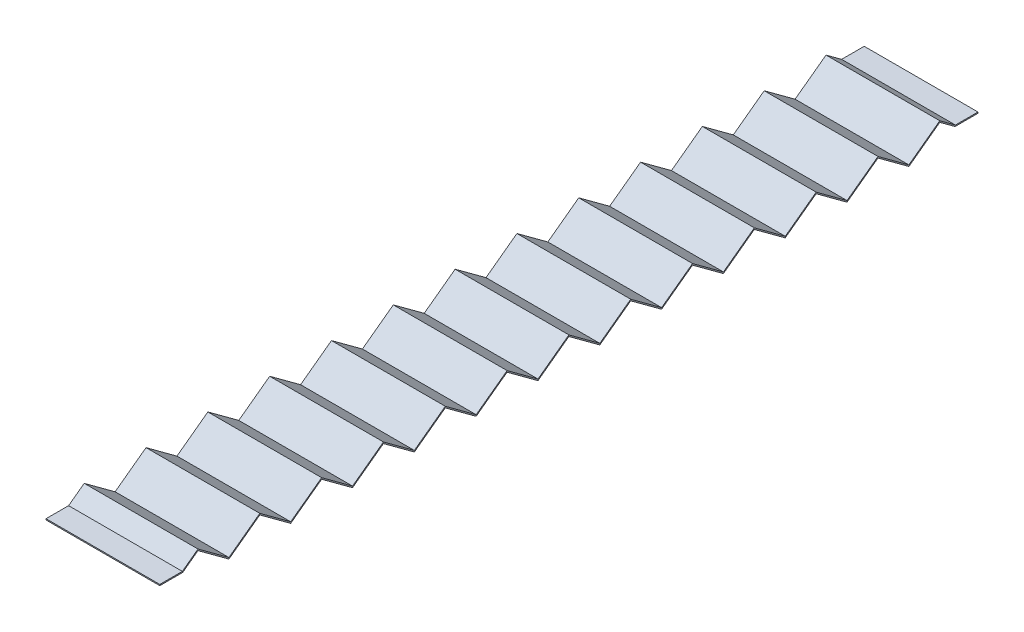
from build123d import *

# Parameters (mm, degrees)
EXTRUDE_THIN1_DEPTH = 25


with BuildPart() as part:
    # Sketch3 → Extrude-Thin1 (new, symmetric)
    with BuildSketch(Plane(origin=(0, 0, 0), x_dir=(0, 0, -1), z_dir=(1, 0, 0))):
        Polygon((0, 4.75), (10.082111158, 4.75), (16.790521412, 9.689539872), (30.371564237, -0.310460128), (43.952607061, 9.689539872), (57.533649886, -0.310460128), (71.114692711, 9.689539872), (84.695735535, -0.310460128), (98.27677836, 9.689539872), (111.857821184, -0.310460128), (125.438864009, 9.689539872), (139.019906833, -0.310460128), (152.600949658, 9.689539872), (166.181992482, -0.310460128), (179.763035307, 9.689539872), (193.344078132, -0.310460128), (206.925120956, 9.689539872), (220.506163781, -0.310460128), (234.087206605, 9.689539872), (247.66824943, -0.310460128), (261.249292254, 9.689539872), (274.830335079, -0.310460128), (288.411377904, 9.689539872), (301.992420728, -0.310460128), (315.573463553, 9.689539872), (329.154506377, -0.310460128), (342.735549202, 9.689539872), (349.443959456, 4.75), (359.526070614, 4.75), (359.526070614, 5.25), (349.608181772, 5.25), (342.735549202, 10.310460128), (329.154506377, 0.310460128), (315.573463553, 10.310460128), (301.992420728, 0.310460128), (288.411377904, 10.310460128), (274.830335079, 0.310460128), (261.249292254, 10.310460128), (247.66824943, 0.310460128), (234.087206605, 10.310460128), (220.506163781, 0.310460128), (206.925120956, 10.310460128), (193.344078132, 0.310460128), (179.763035307, 10.310460128), (166.181992482, 0.310460128), (152.600949658, 10.310460128), (139.019906833, 0.310460128), (125.438864009, 10.310460128), (111.857821184, 0.310460128), (98.27677836, 10.310460128), (84.695735535, 0.310460128), (71.114692711, 10.310460128), (57.533649886, 0.310460128), (43.952607061, 10.310460128), (30.371564237, 0.310460128), (16.790521412, 10.310460128), (9.917888842, 5.25), (0, 5.25), align=None)
    extrude(amount=EXTRUDE_THIN1_DEPTH, both=True)


solid = part.part
